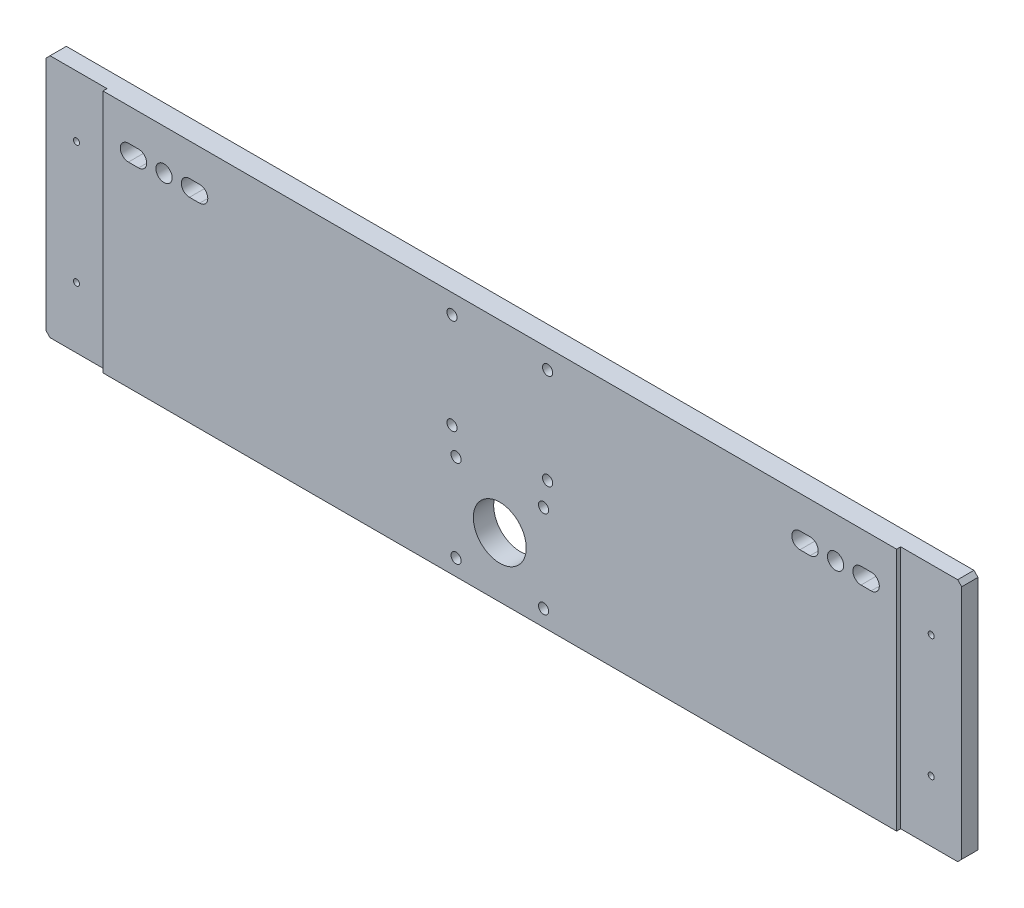
from build123d import *

# Parameters (mm, degrees)
SCHIZZO1_R                   = 13
SCHIZZO1_R_2                 = 4
SCHIZZO1_R_3                 = 1.5
SCHIZZO1_R_4                 = 2.5
ESTRUSIONE_ESTRUSIONE1_DEPTH = 10
SCHIZZO2_W                   = 30
SCHIZZO2_H                   = 120
TAGLIO_ESTRUSIONE1_DEPTH     = 2


with BuildPart() as part:
    # Schizzo1 → Estrusione-Estrusione1 (new body)
    with BuildSketch(Plane.XY):
        Polygon((2, 0), (448, 0), (450, 2), (450, 118), (448, 120), (2, 120), (0, 118), (0, 2), align=None)
        with Locations((225, 29.5)):
            Circle(SCHIZZO1_R, mode=Mode.SUBTRACT)
        with Locations((390, 100)):
            Circle(SCHIZZO1_R_2, mode=Mode.SUBTRACT)
        with Locations((60, 100)):
            Circle(SCHIZZO1_R_2, mode=Mode.SUBTRACT)
        with Locations((15, 30)):
            Circle(SCHIZZO1_R_3, mode=Mode.SUBTRACT)
        with Locations((435, 30)):
            Circle(SCHIZZO1_R_3, mode=Mode.SUBTRACT)
        with Locations((203.5, 51)):
            Circle(SCHIZZO1_R_4, mode=Mode.SUBTRACT)
        with Locations((246.5, 51)):
            Circle(SCHIZZO1_R_4, mode=Mode.SUBTRACT)
        with Locations((246.5, 8)):
            Circle(SCHIZZO1_R_4, mode=Mode.SUBTRACT)
        with Locations((203.5, 8)):
            Circle(SCHIZZO1_R_4, mode=Mode.SUBTRACT)
        with Locations((435, 90)):
            Circle(SCHIZZO1_R_3, mode=Mode.SUBTRACT)
        with Locations((15, 90)):
            Circle(SCHIZZO1_R_3, mode=Mode.SUBTRACT)
        with Locations((248.5, 110.5)):
            Circle(SCHIZZO1_R_4, mode=Mode.SUBTRACT)
        with Locations((248.5, 63.5)):
            Circle(SCHIZZO1_R_4, mode=Mode.SUBTRACT)
        with Locations((201.5, 110.5)):
            Circle(SCHIZZO1_R_4, mode=Mode.SUBTRACT)
        with Locations((201.5, 63.5)):
            Circle(SCHIZZO1_R_4, mode=Mode.SUBTRACT)
        with BuildLine():
            Line((407.5, 96), (402.5, 96))
            ThreePointArc((402.5, 96), (398.5, 100), (402.5, 104))
            Line((402.5, 104), (407.5, 104))
            ThreePointArc((407.5, 104), (411.5, 100), (407.5, 96))
        make_face(mode=Mode.SUBTRACT)
        with BuildLine():
            Line((377.5, 96), (372.5, 96))
            ThreePointArc((372.5, 96), (368.5, 100), (372.5, 104))
            Line((372.5, 104), (377.5, 104))
            ThreePointArc((377.5, 104), (381.5, 100), (377.5, 96))
        make_face(mode=Mode.SUBTRACT)
        with BuildLine():
            Line((42.5, 96), (47.5, 96))
            ThreePointArc((47.5, 96), (51.5, 100), (47.5, 104))
            Line((47.5, 104), (42.5, 104))
            ThreePointArc((42.5, 104), (38.5, 100), (42.5, 96))
        make_face(mode=Mode.SUBTRACT)
        with BuildLine():
            Line((72.5, 96), (77.5, 96))
            ThreePointArc((77.5, 96), (81.5, 100), (77.5, 104))
            Line((77.5, 104), (72.5, 104))
            ThreePointArc((72.5, 104), (68.5, 100), (72.5, 96))
        make_face(mode=Mode.SUBTRACT)
    extrude(amount=-ESTRUSIONE_ESTRUSIONE1_DEPTH)

    # Schizzo2 → Taglio-Estrusione1 (cut)
    with BuildSketch(Plane.XY):
        with Locations((15, 60)):
            Rectangle(SCHIZZO2_W, SCHIZZO2_H)
        with Locations((435, 60)):
            Rectangle(SCHIZZO2_W, SCHIZZO2_H)
    extrude(amount=-TAGLIO_ESTRUSIONE1_DEPTH, mode=Mode.SUBTRACT)


solid = part.part
